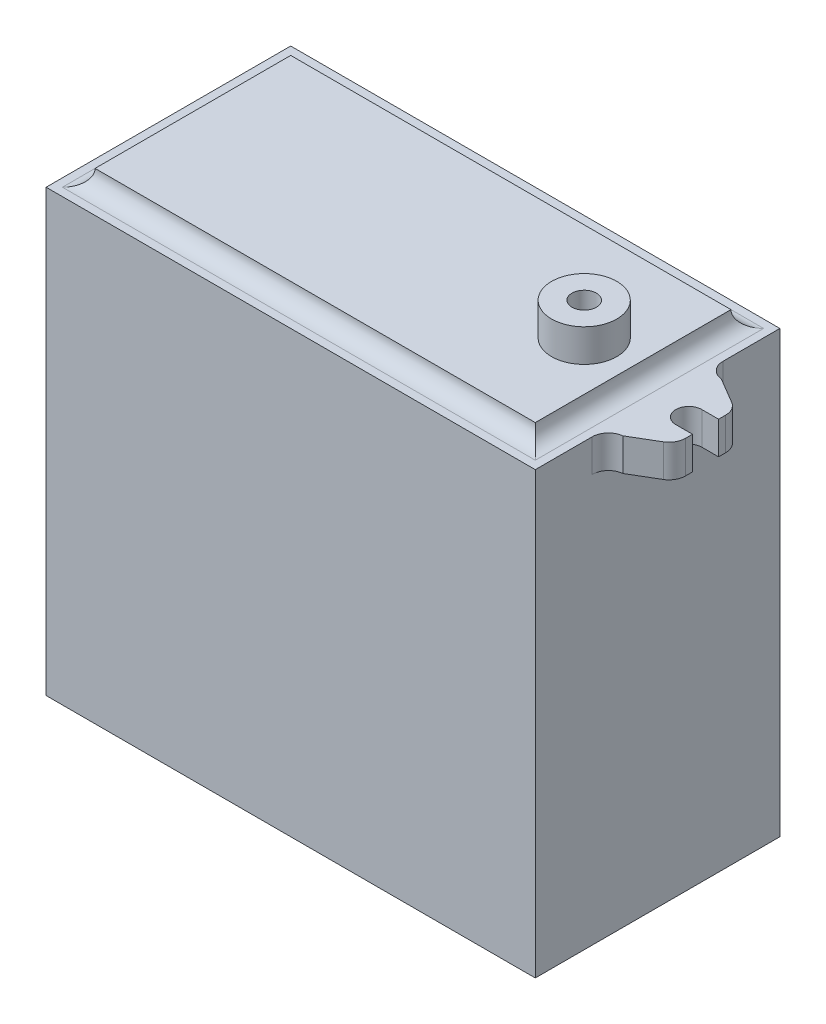
from build123d import *

# Parameters (mm, degrees)
SKETCH1_W           = 30
SKETCH1_H           = 15
BOSS_EXTRUDE1_DEPTH = 27
SKETCH8_W           = 27
SKETCH8_H           = 12
BOSS_EXTRUDE5_DEPTH = 1
FILLET4_R           = 1
SKETCH9_R           = 2
BOSS_EXTRUDE6_DEPTH = 2
SKETCH10_R          = 0.75
CUT_EXTRUDE2_DEPTH  = 2
BOSS_EXTRUDE7_DEPTH = 2
FILLET5_R           = 1


# Some blends are built 0.0001 mm under size
with BuildPart() as part:
    # Sketch1 → Boss-Extrude1 (new body)
    with BuildSketch(Plane(origin=(0, 0, 0), x_dir=(1, 0, 0), z_dir=(0, 1, 0))):
        Rectangle(SKETCH1_W, SKETCH1_H)
    extrude(amount=BOSS_EXTRUDE1_DEPTH)

    # Sketch8 → Boss-Extrude5 (add)
    with BuildSketch(Plane(origin=(0, 27, 0), x_dir=(1, 0, 0), z_dir=(0, 1, 0))):
        Rectangle(SKETCH8_W, SKETCH8_H)
    extrude(amount=BOSS_EXTRUDE5_DEPTH)

    # Fillet4
    fillet4_edges = [part.edges().sort_by_distance(p)[0] for p in [
        (0, 27, 6),
        (13.5, 27, 0),
        (-13.5, 27, 0),
        (0, 27, -6),
    ]]
    fillet(fillet4_edges, radius=FILLET4_R - 0.0001)  # a hair under: the kernel refuses the full size

    # Sketch9 → Boss-Extrude6 (add)
    with BuildSketch(Plane(origin=(0, 28, 0), x_dir=(1, 0, 0), z_dir=(0, 1, 0))):
        with Locations(Location((10.5, 0, 0), (0, 0, 270))):
            Circle(SKETCH9_R)
    extrude(amount=BOSS_EXTRUDE6_DEPTH)

    # Sketch10 → Cut-Extrude2 (cut)
    with BuildSketch(Plane(origin=(0, 30, 0), x_dir=(1, 0, 0), z_dir=(0, 1, 0))):
        with Locations(Location((10.5, 0, 0), (0, 0, 270))):
            Circle(SKETCH10_R)
    extrude(amount=-CUT_EXTRUDE2_DEPTH, mode=Mode.SUBTRACT)

    # Sketch11 → Boss-Extrude7 (add)
    with BuildSketch(Plane(origin=(0, 27, 0), x_dir=(1, 0, 0), z_dir=(0, 1, 0))):
        with BuildLine():
            Line((15, 3.017710153), (15.890097225, 3.017710153))
            Line((15.890097225, 3.017710153), (17.939578486, 1.806653045))
            Line((17.939578486, 1.806653045), (17.939578486, 0.8))
            Line((17.939578486, 0.8), (16.914837856, 0.8))
            ThreePointArc((16.914837856, 0.8), (16.114837856, 0), (16.914837856, -0.8))
            Line((16.914837856, -0.8), (17.939578486, -0.8))
            Line((17.939578486, -0.8), (17.939578486, -1.806653045))
            Line((17.939578486, -1.806653045), (15.890097225, -3.017710153))
            Line((15.890097225, -3.017710153), (15, -3.017710153))
            Line((15, -3.017710153), (15, 3.017710153))
        make_face()
    extrude(amount=-BOSS_EXTRUDE7_DEPTH)

    # Fillet5
    # the kernel refuses this fillet: 1 mm, written as the material it adds along each edge
    with BuildSketch(Plane(origin=(15, 27, 3.017710153), x_dir=(0, 0, 1), z_dir=(0, -1, 0))) as fillet5_piece_1:
        with BuildLine():
            CenterArc((0.993942342, -1), FILLET5_R, 90, 83.690289012)
            Line((0, -0.890097225), (0, 0))
            Line((0, 0), (0.993942342, 0))
        make_face()
    extrude(amount=2)
    with BuildSketch(Plane(origin=(15, 27, -3.017710153), x_dir=(0, 0, -1), z_dir=(0, -1, 0))) as fillet5_piece_2:
        with BuildLine():
            CenterArc((0.993942342, 1), FILLET5_R, 186.309710988, 83.690289012)
            Line((0, 0.890097225), (0, 0))
            Line((0, 0), (0.993942342, 0))
        make_face()
    extrude(amount=2)
    # the kernel refuses this fillet: 1 mm, written as the material it takes off along each edge
    with BuildSketch(Plane(origin=(17.939578486, 28.426575532, -1.806653045), x_dir=(0, 0, 1), z_dir=(0, -1, 0)), Plane(origin=(17.939578486, 28.426575532, 1.806653045), x_dir=(-0.8609265282144232, 0, 0.5087293121264587), z_dir=(0, -1, 0))) as fillet5_2_piece_1:
        with BuildLine():
            CenterArc((FILLET5_R * 0.570630212653, FILLET5_R), FILLET5_R, 210.579226872, 59.420773128)
            Line((-FILLET5_R * 0.290296315561, FILLET5_R * 0.491270687874), (0, 0))
            Line((0, 0), (FILLET5_R * 0.570630212653, 0))
        make_face()
    extrude(amount=4.853151063, mode=Mode.SUBTRACT)


solid = part.part
